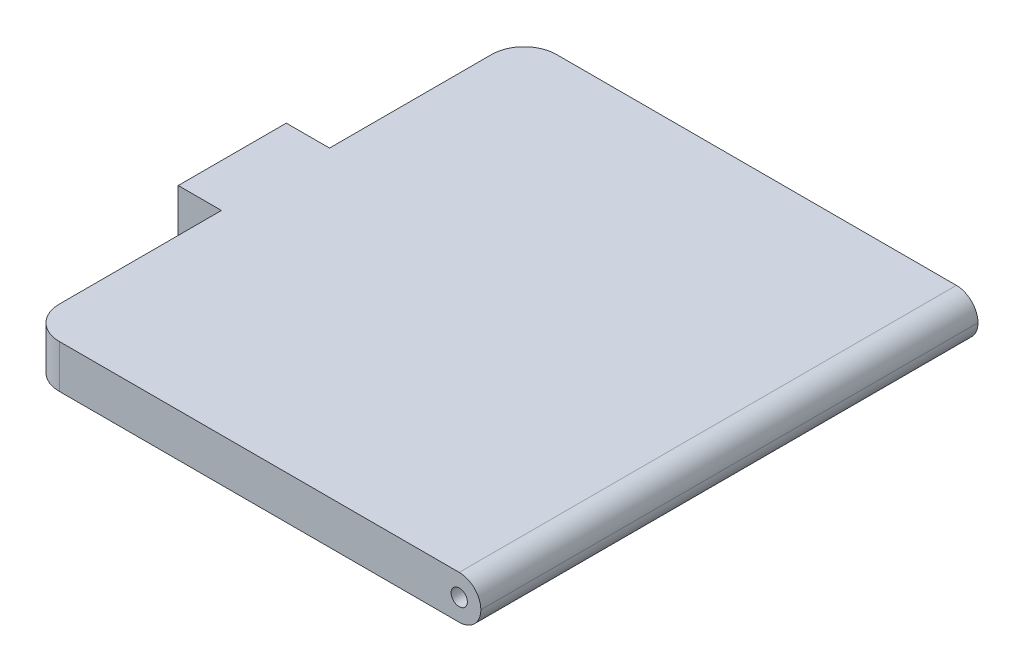
from build123d import *

# Parameters (mm, degrees)
BOSS_EXTRUDE1_DEPTH = 4
FILLET1_R           = 2
SKETCH2_R           = 0.75
CUT_EXTRUDE1_DEPTH  = 46
SKETCH4_W           = 10
SKETCH4_H           = 3
BOSS_EXTRUDE2_DEPTH = 4
SKETCH6_W           = 2
SKETCH6_H           = 10
BOSS_EXTRUDE3_DEPTH = 5


with BuildPart() as part:
    # Sketch1 → Boss-Extrude1 (new body)
    with BuildSketch(Plane(origin=(0, 0, 0), x_dir=(1, 0, 0), z_dir=(0, 1, 0))):
        with BuildLine():
            Line((-1, 23), (-1, -23))
            Line((-1, -23), (-40, -23))
            ThreePointArc((-40, -23), (-42.121320344, -22.121320344), (-43, -20))
            Line((-43, -20), (-43, 20))
            ThreePointArc((-43, 20), (-42.121320344, 22.121320344), (-40, 23))
            Line((-40, 23), (-1, 23))
        make_face()
    extrude(amount=BOSS_EXTRUDE1_DEPTH)

    # Fillet1
    fillet1_edges = [part.edges().sort_by_distance(p)[0] for p in [
        (-1, 0, 0),
        (-1, 4, 0),
    ]]
    fillet(fillet1_edges, radius=FILLET1_R - 0.0001)  # a hair under: the kernel refuses the full size

    # Sketch2 → Cut-Extrude1 (cut)
    with BuildSketch(Plane.XY.offset(23)):
        with Locations((-3, 2)):
            Circle(SKETCH2_R)
    extrude(amount=-CUT_EXTRUDE1_DEPTH, mode=Mode.SUBTRACT)

    # Sketch4 → Boss-Extrude2 (add)
    with BuildSketch(Plane.ZY.offset(43)):
        with Locations((0, 2.5)):
            Rectangle(SKETCH4_W, SKETCH4_H)
    extrude(amount=BOSS_EXTRUDE2_DEPTH)

    # Sketch6 → Boss-Extrude3 (add)
    with BuildSketch(Plane.XZ.offset(-1)):
        with Locations((-46, 0)):
            Rectangle(SKETCH6_W, SKETCH6_H)
    extrude(amount=BOSS_EXTRUDE3_DEPTH)


solid = part.part
